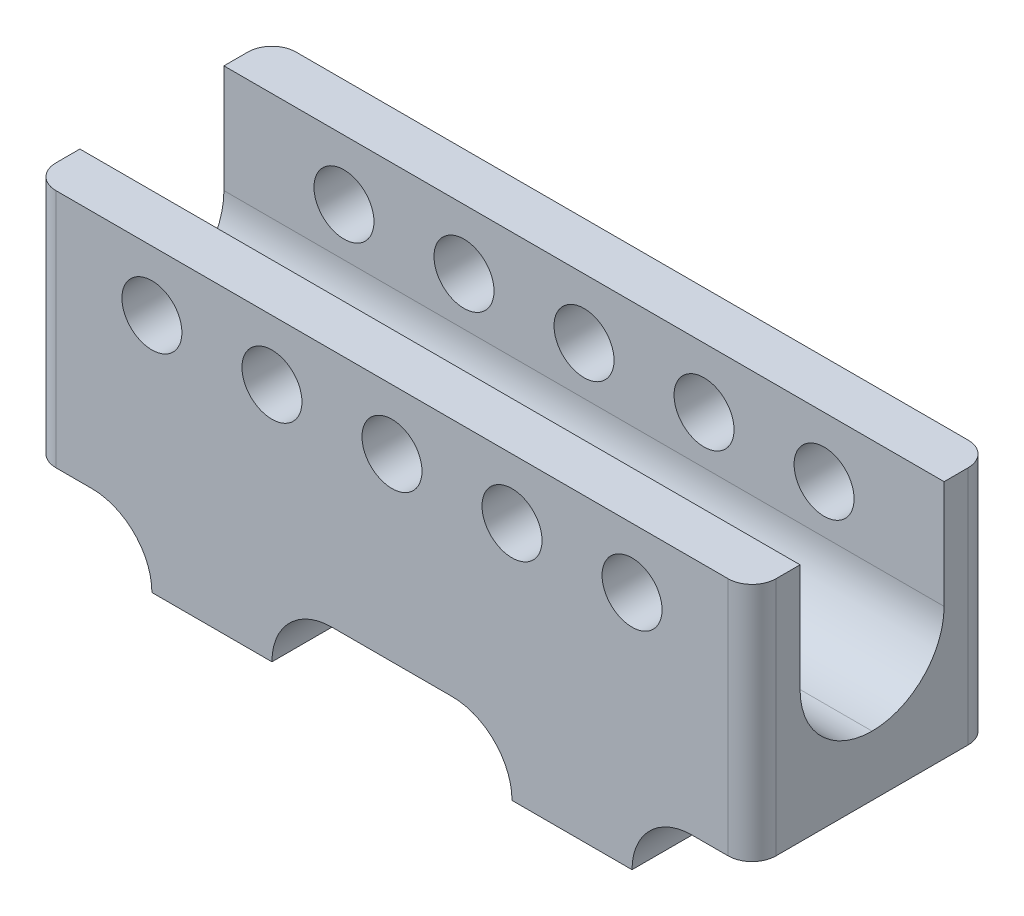
from build123d import *

# Parameters (mm, degrees)
SKETCH1_W                                           = 76.2
SKETCH1_H                                           = 25.4
BOSS_EXTRUDE1_DEPTH                                 = 31.75
CUT_EXTRUDE1_REACH                                  = 85.521
SKETCH2_W                                           = 15.24
SKETCH2_H                                           = 19.05
SKETCH3_R                                           = 3.175
CUT_EXTRUDE2_DEPTH                                  = 56.72102386
LPATTERN1_COUNT                                     = 5
LPATTERN1_PITCH                                     = 12.7
CBORE_FOR_6_BINDING_HEAD_MACHINE_SCREW1_D           = 3.7973
CBORE_FOR_6_BINDING_HEAD_MACHINE_SCREW1_CBORE_D     = 7.9375
CBORE_FOR_6_BINDING_HEAD_MACHINE_SCREW1_CBORE_DEPTH = 2.2098
FILLET2_R                                           = 7.62
CUT_EXTRUDE3_REACH                                  = 57.721
SKETCH7_W                                           = 12.7
SKETCH7_H                                           = 6.35
SKETCH7_W_2                                         = 25.4
FILLET5_R                                           = 6.35
FILLET6_R                                           = 2.54


# Some blends are built 0.0001 mm under size
with BuildPart() as part:
    # Sketch1 → Boss-Extrude1 (new body)
    with BuildSketch(Plane(origin=(0, 0, 0), x_dir=(1, 0, 0), z_dir=(0, 1, 0))):
        Rectangle(SKETCH1_W, SKETCH1_H)
    extrude(amount=BOSS_EXTRUDE1_DEPTH)

    # Sketch2 → Cut-Extrude1 (cut, up to next)
    with BuildSketch(Plane(origin=(38.1, 0, 0), x_dir=(0, 0, -1), z_dir=(1, 0, 0)), mode=Mode.PRIVATE) as cut_extrude1_sk1:
        with Locations((0, 22.225)):
            Rectangle(SKETCH2_W, SKETCH2_H)
    cut_extrude1_tool1 = extrude(cut_extrude1_sk1.sketch, amount=-CUT_EXTRUDE1_REACH, mode=Mode.PRIVATE) & part.part
    add(cut_extrude1_tool1.solids().sort_by_distance((38.1, 22.225, 0))[0], mode=Mode.SUBTRACT)

    # Sketch3 → Cut-Extrude2 (cut, through all)
    with BuildSketch(Plane.XY.offset(12.7)):
        with Locations((-25.4, 25.4)):
            Circle(SKETCH3_R)
    cut_extrude2 = extrude(amount=-CUT_EXTRUDE2_DEPTH, mode=Mode.SUBTRACT)

    # LPattern1: Cut-Extrude2 ×5
    with Locations(*[(i * LPATTERN1_PITCH, 0, 0) for i in range(1, LPATTERN1_COUNT)]):
        add(cut_extrude2, mode=Mode.SUBTRACT)

    # CBORE for #6 Binding Head Machine Screw1 (through all)
    with Locations(Plane(origin=(0, 12.7, 0), x_dir=(1, 0, 0), z_dir=(0, 1, 0))):
        with Locations((-19.05, 0), (19.05, 0)):
            CounterBoreHole(CBORE_FOR_6_BINDING_HEAD_MACHINE_SCREW1_D / 2, CBORE_FOR_6_BINDING_HEAD_MACHINE_SCREW1_CBORE_D / 2, CBORE_FOR_6_BINDING_HEAD_MACHINE_SCREW1_CBORE_DEPTH)

    # Fillet2
    # the kernel refuses this fillet: 7.62 mm, written as the material it adds along each edge
    with BuildSketch(Plane(origin=(38.1, 12.7, -7.62), x_dir=(0, 1, 0), z_dir=(-1, 0, 0))) as fillet2_piece_1_section:
        with BuildLine():
            CenterArc((FILLET2_R, -FILLET2_R), FILLET2_R, 90, 90)
            Line((0, -FILLET2_R), (0, 0))
            Line((0, 0), (FILLET2_R, 0))
        make_face()
    fillet2_piece_1 = extrude(amount=76.2, mode=Mode.PRIVATE)
    fillet2_piece_1 = fillet2_piece_1 - Plane(origin=(-19.05, 14.454782772, 0), x_dir=(1, 0, 0), z_dir=(0, 1, 0)) * Cylinder(3.96875, 183, mode=Mode.PRIVATE)
    fillet2_piece_1 = fillet2_piece_1 - Plane(origin=(19.05, 14.454782772, 0), x_dir=(1, 0, 0), z_dir=(0, 1, 0)) * Cylinder(3.96875, 183, mode=Mode.PRIVATE)
    add(fillet2_piece_1)
    with BuildSketch(Plane(origin=(38.1, 12.7, 7.62), x_dir=(0, 0, -1), z_dir=(-1, 0, 0))) as fillet2_piece_2_section:
        with BuildLine():
            CenterArc((FILLET2_R, -FILLET2_R), FILLET2_R, 90, 90)
            Line((0, -FILLET2_R), (0, 0))
            Line((0, 0), (FILLET2_R, 0))
        make_face()
    fillet2_piece_2 = extrude(amount=76.2, mode=Mode.PRIVATE)
    fillet2_piece_2 = fillet2_piece_2 - Plane(origin=(-19.05, 14.454782936, 0), x_dir=(1, 0, 0), z_dir=(0, 1, 0)) * Cylinder(3.96875, 183, mode=Mode.PRIVATE)
    fillet2_piece_2 = fillet2_piece_2 - Plane(origin=(19.05, 14.454782936, 0), x_dir=(1, 0, 0), z_dir=(0, 1, 0)) * Cylinder(3.96875, 183, mode=Mode.PRIVATE)
    add(fillet2_piece_2)

    # Sketch7 → Cut-Extrude3 (cut, up to next)
    with BuildSketch(Plane.XY.offset(12.7), mode=Mode.PRIVATE) as cut_extrude3_sk1:
        with Locations((-31.75, 3.175)):
            Rectangle(SKETCH7_W, SKETCH7_H)
    cut_extrude3_tool1 = extrude(cut_extrude3_sk1.sketch, amount=-CUT_EXTRUDE3_REACH, mode=Mode.PRIVATE) & part.part
    # Sketch7 → Cut-Extrude3 (cut, up to next)
    with BuildSketch(Plane.XY.offset(12.7), mode=Mode.PRIVATE) as cut_extrude3_sk2:
        with Locations((31.75, 3.175)):
            Rectangle(SKETCH7_W, SKETCH7_H)
    cut_extrude3_tool2 = extrude(cut_extrude3_sk2.sketch, amount=-CUT_EXTRUDE3_REACH, mode=Mode.PRIVATE) & part.part
    # Sketch7 → Cut-Extrude3 (cut, up to next)
    with BuildSketch(Plane.XY.offset(12.7), mode=Mode.PRIVATE) as cut_extrude3_sk3:
        with Locations((0, 3.175)):
            Rectangle(SKETCH7_W_2, SKETCH7_H)
    cut_extrude3_tool3 = extrude(cut_extrude3_sk3.sketch, amount=-CUT_EXTRUDE3_REACH, mode=Mode.PRIVATE) & part.part
    add(cut_extrude3_tool1.solids().sort_by_distance((-31.75, 3.175, 12.7))[0], mode=Mode.SUBTRACT)
    add(cut_extrude3_tool2.solids().sort_by_distance((31.75, 3.175, 12.7))[0], mode=Mode.SUBTRACT)
    add(cut_extrude3_tool3.solids().sort_by_distance((0, 3.175, 12.7))[0], mode=Mode.SUBTRACT)

    # Fillet5
    fillet5_edges = [part.edges().sort_by_distance(p)[0] for p in [
        (-25.4, 6.35, 0),
        (-12.7, 6.35, 0),
        (12.7, 6.35, 0),
        (25.4, 6.35, 0),
    ]]
    fillet(fillet5_edges, radius=FILLET5_R - 0.0001)  # a hair under: the kernel refuses the full size

    # Fillet6
    fillet6_edges = [part.edges().sort_by_distance(p)[0] for p in [
        (-38.1, 19.05, -12.7),
        (38.1, 19.05, -12.7),
        (38.1, 19.05, 12.7),
        (-38.1, 19.05, 12.7),
    ]]
    fillet(fillet6_edges, radius=FILLET6_R)


solid = part.part
